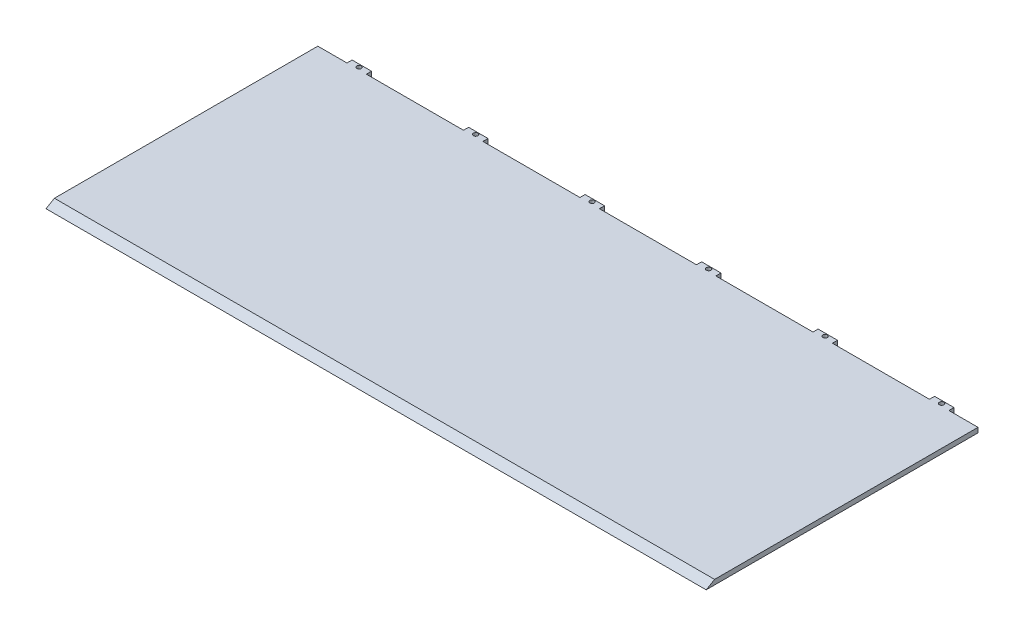
from build123d import *

# Parameters (mm, degrees)
SKETCH1_W                   = 431.8
SKETCH1_H                   = 177.8
BOSS_EXTRUDE1_DEPTH         = 3.175
SKETCH2_W                   = 12.7
SKETCH2_H                   = 3.3655
BOSS_EXTRUDE2_DEPTH         = 3.175
F_32_0_116_DIAMETER_HOLE1_D = 2.9464
LPATTERN1_COUNT             = 6
LPATTERN1_PITCH             = 76.2
CUT_EXTRUDE1_DEPTH          = 469.275836463
CUT_EXTRUDE1_DEPTH_BACK     = 469.275836463


with BuildPart() as part:
    # Sketch1 → Boss-Extrude1 (new body)
    with BuildSketch(Plane(origin=(0, 0, 0), x_dir=(1, 0, 0), z_dir=(0, 1, 0))):
        with Locations((215.9, 88.9)):
            Rectangle(SKETCH1_W, SKETCH1_H)
    extrude(amount=BOSS_EXTRUDE1_DEPTH)

    # Sketch2 → Boss-Extrude2 (add)
    with BuildSketch(Plane(origin=(0, 3.175, 0), x_dir=(1, 0, 0), z_dir=(0, 1, 0))):
        with Locations((25.4, 179.48275)):
            Rectangle(SKETCH2_W, SKETCH2_H)
    boss_extrude2 = extrude(amount=-BOSS_EXTRUDE2_DEPTH)

    # #32 (0.116) Diameter Hole1 (through all)
    with Locations(Plane(origin=(0, 3.175, 0), x_dir=(1, 0, 0), z_dir=(0, 1, 0))):
        with Locations((25.415323203, 179.3875)):
            f_32_0_116_diameter_hole1 = Hole(F_32_0_116_DIAMETER_HOLE1_D / 2)

    # LPattern1: Boss-Extrude2, #32 (0.116) Diameter Hole1 ×6
    with Locations(*[(i * LPATTERN1_PITCH, 0, 0) for i in range(1, LPATTERN1_COUNT)]):
        add(boss_extrude2)
        add(f_32_0_116_diameter_hole1, mode=Mode.SUBTRACT)

    # Sketch6 → Cut-Extrude1 (cut, two sides: drawn at the far end of the back side and taken through both)
    with BuildSketch(Plane.ZY.offset(-CUT_EXTRUDE1_DEPTH_BACK)):
        Polygon((322.496289327, -186.193319455), (0, 0), (-5.499261314, 3.175), (-327.995550641, 189.368319455), (44.39108827, 834.360898109), (694.882928237, 458.799259198), align=None)
    extrude(amount=CUT_EXTRUDE1_DEPTH + CUT_EXTRUDE1_DEPTH_BACK, mode=Mode.SUBTRACT)


solid = part.part
